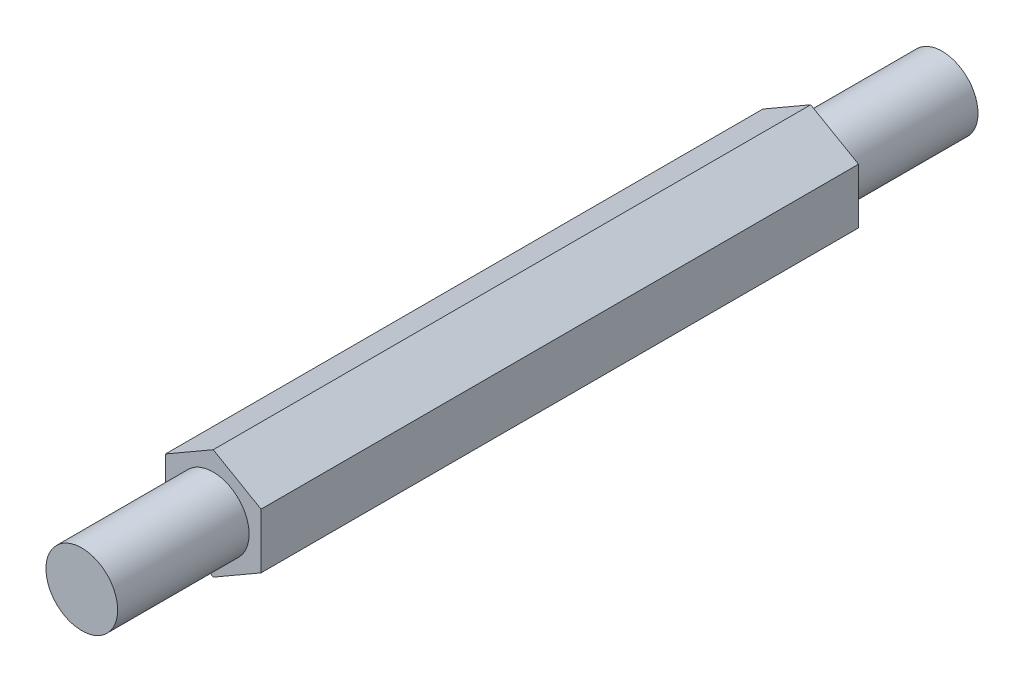
from build123d import *

# Parameters (mm, degrees)
BOSS_EXTRUDE1_DEPTH = 79.375
SKETCH1_3_R         = 9.525
BOSS_EXTRUDE2_DEPTH = 114.3


with BuildPart() as part:
    # Sketch1 → Boss-Extrude1 (new, symmetric)
    with BuildSketch(Plane.XY):
        Polygon((-12.7, -7.332348419), (0, -14.664696837), (12.7, -7.332348419), (12.7, 7.332348419), (0, 14.664696837), (-12.7, 7.332348419), align=None)
    extrude(amount=BOSS_EXTRUDE1_DEPTH, both=True)

    # Sketch1<3> → Boss-Extrude2 (add, symmetric)
    with BuildSketch(Plane.XY):
        Circle(SKETCH1_3_R)
    extrude(amount=BOSS_EXTRUDE2_DEPTH, both=True)


solid = part.part
